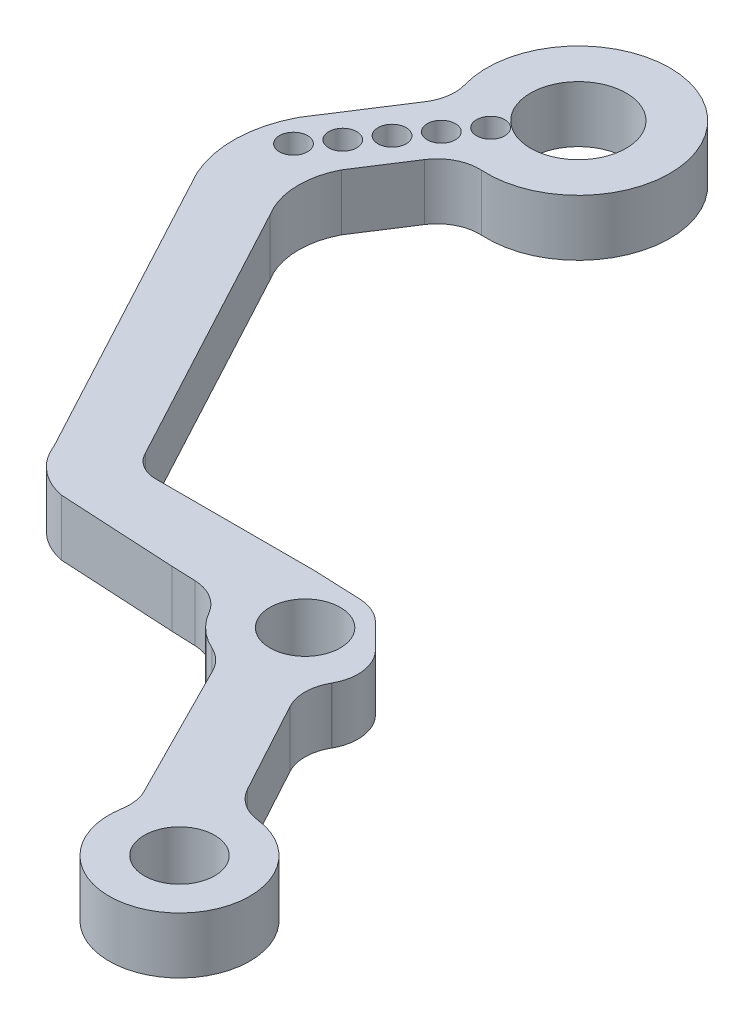
from build123d import *

# Parameters (mm, degrees)
SKETCH2_R           = 2.5
SKETCH2_R_2         = 3.4
BOSS_EXTRUDE1_DEPTH = 4
FILLET1_R           = 3
CUT_EXTRUDE2_REACH  = 145.056
SKETCH3_R           = 1


with BuildPart() as part:
    # Sketch2 → Boss-Extrude1 (new body)
    with BuildSketch(Plane(origin=(0, 0, 0), x_dir=(1, 0, 0), z_dir=(0, 1, 0))):
        with BuildLine():
            ThreePointArc((49.0624911, 100.728722197), (55.253975507, 111.876765002), (45.278809785, 103.932622106))
            Line((45.278809785, 103.932622106), (41.677103445, 98.359455452))
            Line((41.677103445, 98.359455452), (40.917682236, 97.184351056))
            ThreePointArc((40.917682236, 97.184351056), (40.000914232, 93.684113367), (40.729811239, 90.139986308))
            Line((40.729811239, 90.139986308), (51.995593872, 69.121735128))
            Line((51.995593872, 69.121735128), (52.448751423, 68.276291936))
            ThreePointArc((52.448751423, 68.276291936), (53.733769558, 66.46917356), (55.737555004, 65.519546097))
            Line((55.737555004, 65.519546097), (56.575581952, 65.474059755))
            Line((56.575581952, 65.474059755), (56.904280571, 65.456218685))
            Line((56.904280571, 65.456218685), (64.043852088, 65.068697747))
            Line((64.043852088, 65.068697747), (67.659658755, 64.927019071))
            ThreePointArc((67.659658755, 64.927019071), (68.973857559, 62.514332624), (71.364365032, 61.16020988))
            Line((71.364365032, 61.16020988), (77.3922419, 49.235496946))
            ThreePointArc((77.3922419, 49.235496946), (85.295038859, 43.696471142), (81.278467798, 52.471558808))
            Line((81.278467798, 52.471558808), (75.926202221, 62.342787356))
            ThreePointArc((75.926202221, 62.342787356), (77.117833046, 64.012589982), (77.538655529, 66.020358214))
            Line((77.538655529, 66.020358214), (73.882441794, 69.676571949))
            Line((73.882441794, 69.676571949), (69.341583584, 69.864669723))
            Line((69.341583584, 69.864669723), (65.404712603, 69.864669723))
            Line((65.404712603, 69.864669723), (58.04793187, 69.864669723))
            ThreePointArc((58.04793187, 69.864669723), (56.992330015, 70.157110244), (56.212176606, 70.925990854))
            ThreePointArc((56.212176606, 70.925990854), (56.161986001, 71.014595828), (56.115987655, 71.105447853))
            Line((56.115987655, 71.105447853), (45.913475043, 90.139986308))
            ThreePointArc((45.913475043, 90.139986308), (45.708651409, 90.489699119), (45.530826332, 90.853883157))
            ThreePointArc((45.530826332, 90.853883157), (45.074746145, 93.175228741), (45.661998303, 95.466907026))
            Line((45.661998303, 95.466907026), (49.0624911, 100.728722197))
        make_face()
        with Locations((82.095552315, 47.538773298)):
            Circle(SKETCH2_R, mode=Mode.SUBTRACT)
        with Locations((72.538655529, 66.020358214)):
            Circle(SKETCH2_R, mode=Mode.SUBTRACT)
        with Locations((51.053576092, 106.916256485)):
            Circle(SKETCH2_R_2, mode=Mode.SUBTRACT)
    extrude(amount=BOSS_EXTRUDE1_DEPTH)

    # Fillet1
    fillet1_edges = [part.edges().sort_by_distance(p)[0] for p in [
        (77.538655529, 2, -66.020358214),
        (73.882441794, 2, -69.676571949),
        (75.926202221, 2, -62.342787356),
        (77.3922419, 2, -49.235496946),
        (81.278467798, 2, -52.471558808),
        (71.364365032, 2, -61.16020988),
        (67.659658755, 2, -64.927019071),
        (45.278809785, 2, -103.932622106),
        (49.0624911, 2, -100.728722197),
    ]]
    fillet(fillet1_edges, radius=FILLET1_R)

    # Sketch3 → Cut-Extrude2 (cut, up to next)
    with BuildSketch(Plane(origin=(0, 4, 0), x_dir=(1, 0, 0), z_dir=(0, 1, 0)), mode=Mode.PRIVATE) as cut_extrude2_sk1:
        with Locations((48.374282672, 103.36324554)):
            Circle(SKETCH3_R)
    cut_extrude2_tool1 = extrude(cut_extrude2_sk1.sketch, amount=-CUT_EXTRUDE2_REACH, mode=Mode.PRIVATE) & part.part
    # Sketch3 → Cut-Extrude2 (cut, up to next)
    with BuildSketch(Plane(origin=(0, 4, 0), x_dir=(1, 0, 0), z_dir=(0, 1, 0)), mode=Mode.PRIVATE) as cut_extrude2_sk2:
        with Locations((46.86906165, 101.367171976)):
            Circle(SKETCH3_R)
    cut_extrude2_tool2 = extrude(cut_extrude2_sk2.sketch, amount=-CUT_EXTRUDE2_REACH, mode=Mode.PRIVATE) & part.part
    # Sketch3 → Cut-Extrude2 (cut, up to next)
    with BuildSketch(Plane(origin=(0, 4, 0), x_dir=(1, 0, 0), z_dir=(0, 1, 0)), mode=Mode.PRIVATE) as cut_extrude2_sk3:
        with Locations((45.363840628, 99.371098411)):
            Circle(SKETCH3_R)
    cut_extrude2_tool3 = extrude(cut_extrude2_sk3.sketch, amount=-CUT_EXTRUDE2_REACH, mode=Mode.PRIVATE) & part.part
    # Sketch3 → Cut-Extrude2 (cut, up to next)
    with BuildSketch(Plane(origin=(0, 4, 0), x_dir=(1, 0, 0), z_dir=(0, 1, 0)), mode=Mode.PRIVATE) as cut_extrude2_sk4:
        with Locations((43.858619606, 97.375024847)):
            Circle(SKETCH3_R)
    cut_extrude2_tool4 = extrude(cut_extrude2_sk4.sketch, amount=-CUT_EXTRUDE2_REACH, mode=Mode.PRIVATE) & part.part
    # Sketch3 → Cut-Extrude2 (cut, up to next)
    with BuildSketch(Plane(origin=(0, 4, 0), x_dir=(1, 0, 0), z_dir=(0, 1, 0)), mode=Mode.PRIVATE) as cut_extrude2_sk5:
        with Locations((42.353398584, 95.378951282)):
            Circle(SKETCH3_R)
    cut_extrude2_tool5 = extrude(cut_extrude2_sk5.sketch, amount=-CUT_EXTRUDE2_REACH, mode=Mode.PRIVATE) & part.part
    add(cut_extrude2_tool1.solids().sort_by_distance((48.374283, 4, -103.363246))[0], mode=Mode.SUBTRACT)
    add(cut_extrude2_tool2.solids().sort_by_distance((46.869062, 4, -101.367172))[0], mode=Mode.SUBTRACT)
    add(cut_extrude2_tool3.solids().sort_by_distance((45.363841, 4, -99.371098))[0], mode=Mode.SUBTRACT)
    add(cut_extrude2_tool4.solids().sort_by_distance((43.85862, 4, -97.375025))[0], mode=Mode.SUBTRACT)
    add(cut_extrude2_tool5.solids().sort_by_distance((42.353399, 4, -95.378951))[0], mode=Mode.SUBTRACT)


solid = part.part
